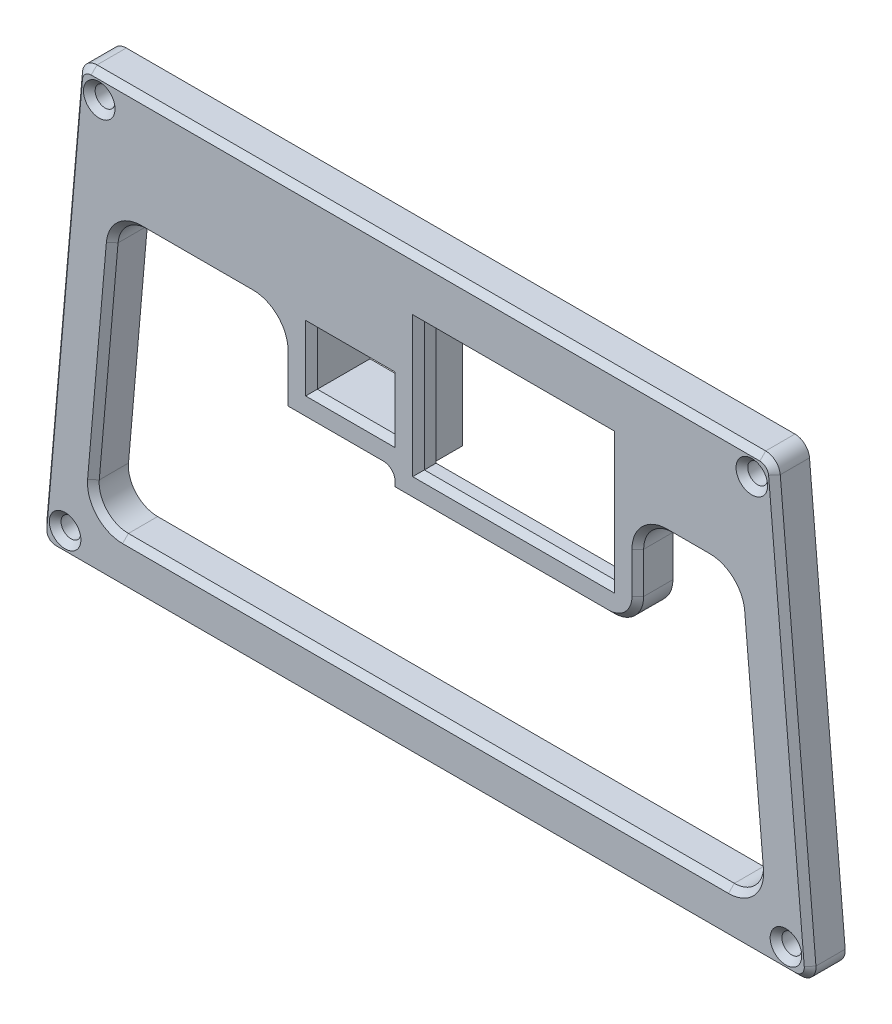
from build123d import *

# Parameters (mm, degrees)
SKETCH1_W                 = 37.50000004
SKETCH1_H                 = 31.999999963
BOSS_EXTRUDE1_DEPTH       = 3
SKETCH2_W                 = 6
SKETCH2_H                 = 61.71460232
BOSS_EXTRUDE2_DEPTH       = 25.662738028
SKETCH3_W                 = 63.162738068
SKETCH3_H                 = 6
BOSS_EXTRUDE3_DEPTH       = 5.000000037
SKETCH4_W                 = 63.162738068
SKETCH4_H                 = 6
BOSS_EXTRUDE4_DEPTH       = 8
SKETCH5_W                 = 6
SKETCH5_H                 = 74.714602357
BOSS_EXTRUDE5_DEPTH       = 55.76390052
CUT_EXTRUDE1_DEPTH        = 2.499999998
SKETCH7_W                 = 6
SKETCH7_H                 = 32.514602357
CUT_EXTRUDE2_DEPTH        = 18.3
SKETCH8_W                 = 6
SKETCH8_H                 = 29.714602357
CUT_EXTRUDE3_DEPTH        = 2.5
SKETCH9_W                 = 6
SKETCH9_H                 = 46.714602358
CUT_EXTRUDE4_DEPTH        = 20.968950764
SKETCH10_W                = 6
SKETCH10_H                = 46.714602357
CUT_EXTRUDE5_DEPTH        = 32.770113219
SKETCH11_W                = 20.8
SKETCH11_H                = 19.200000012
BOSS_EXTRUDE6_DEPTH       = 4
SKETCH12_W                = 32.5
SKETCH12_H                = 22
CUT_EXTRUDE6_DEPTH        = 187.686043948
SKETCH13_W                = 13.3
SKETCH13_H                = 9.2
CUT_EXTRUDE7_DEPTH        = 187.686043948
DRAFT1_ANGLE              = -5
DRAFT2_ANGLE              = 5
F_4_CLEARANCE_HOLE1_D     = 3.4
F_4_CLEARANCE_HOLE1_DEPTH = 10
FILLET1_R                 = 1
FILLET2_R                 = 2.5
FILLET3_R                 = 5
CHAMFER1_SIZE             = 1


with BuildPart() as part:
    # Sketch1 → Boss-Extrude1 (new body)
    with BuildSketch(Plane.XY.offset(3)):
        with Locations((-62.281298008, 105.644197082)):
            Rectangle(SKETCH1_W, SKETCH1_H)
    extrude(amount=-BOSS_EXTRUDE1_DEPTH)

    # Sketch2 → Boss-Extrude2 (add)
    with BuildSketch(Plane(origin=(-43.531297988, 0, 0), x_dir=(0, 0, -1), z_dir=(1, 0, 0))):
        with Locations((0, 90.786895904)):
            Rectangle(SKETCH2_W, SKETCH2_H)
    extrude(amount=BOSS_EXTRUDE2_DEPTH)

    # Sketch3 → Boss-Extrude3 (add)
    with BuildSketch(Plane(origin=(0, 121.644197064, 0), x_dir=(-1, 0, 0), z_dir=(0, 1, 0))):
        with Locations((49.449928994, 0)):
            Rectangle(SKETCH3_W, SKETCH3_H)
    extrude(amount=BOSS_EXTRUDE3_DEPTH)

    # Sketch4 → Boss-Extrude4 (add)
    with BuildSketch(Plane.XZ.offset(-59.929594744)):
        with Locations((-49.449928994, 0)):
            Rectangle(SKETCH4_W, SKETCH4_H)
    extrude(amount=BOSS_EXTRUDE4_DEPTH)

    # Sketch5 → Boss-Extrude5 (add)
    with BuildSketch(Plane.ZY.offset(81.031298028)):
        with Locations((0, 89.286895923)):
            Rectangle(SKETCH5_W, SKETCH5_H)
    extrude(amount=BOSS_EXTRUDE5_DEPTH)

    # Sketch6 → Cut-Extrude1 (cut)
    with BuildSketch(Plane(origin=(-81.031298028, 0, 0), x_dir=(0, 0, -1), z_dir=(1, 0, 0))):
        Polygon((0, 89.644197101), (-3, 89.644197101), (-3, 59.929594744), (3, 59.929594744), (3, 92.444197101), (0, 92.444197101), align=None)
    extrude(amount=-CUT_EXTRUDE1_DEPTH, mode=Mode.SUBTRACT)

    # Sketch7 → Cut-Extrude2 (cut)
    with BuildSketch(Plane(origin=(-83.531298026, 0, 0), x_dir=(0, 0, -1), z_dir=(1, 0, 0))):
        with Locations((0, 76.186895922)):
            Rectangle(SKETCH7_W, SKETCH7_H)
    extrude(amount=-CUT_EXTRUDE2_DEPTH, mode=Mode.SUBTRACT)

    # Sketch8 → Cut-Extrude3 (cut)
    with BuildSketch(Plane.ZY.offset(43.531297988)):
        with Locations((0, 74.786895923)):
            Rectangle(SKETCH8_W, SKETCH8_H)
    extrude(amount=-CUT_EXTRUDE3_DEPTH, mode=Mode.SUBTRACT)

    # Sketch9 → Cut-Extrude4 (cut)
    with BuildSketch(Plane.ZY.offset(41.031297988)):
        with Locations((-1.31e-07, 83.286895949)):
            Rectangle(SKETCH9_W, SKETCH9_H)
    extrude(amount=-CUT_EXTRUDE4_DEPTH, mode=Mode.SUBTRACT)

    # Sketch10 → Cut-Extrude5 (cut)
    with BuildSketch(Plane(origin=(-101.831298026, 0, 0), x_dir=(0, 0, -1), z_dir=(1, 0, 0))):
        with Locations((0, 83.286895923)):
            Rectangle(SKETCH10_W, SKETCH10_H)
    extrude(amount=-CUT_EXTRUDE5_DEPTH, mode=Mode.SUBTRACT)

    # Sketch11 → Boss-Extrude6 (add)
    with BuildSketch(Plane(origin=(0, 0, -3), x_dir=(-1, 0, 0), z_dir=(0, 0, -1))):
        with Locations((91.431298026, 102.044197107)):
            Rectangle(SKETCH11_W, SKETCH11_H)
    extrude(amount=BOSS_EXTRUDE6_DEPTH)

    # Sketch12 → Cut-Extrude6 (cut, through all)
    with BuildSketch(Plane.XY.offset(3)):
        with Locations((-62.281298026, 105.644197101)):
            Rectangle(SKETCH12_W, SKETCH12_H)
    extrude(amount=-CUT_EXTRUDE6_DEPTH, mode=Mode.SUBTRACT)

    # Sketch13 → Cut-Extrude7 (cut, through all)
    with BuildSketch(Plane.XY.offset(3)):
        with Locations((-90.181298026, 102.044197101)):
            Rectangle(SKETCH13_W, SKETCH13_H)
    extrude(amount=-CUT_EXTRUDE7_DEPTH, mode=Mode.SUBTRACT)

    # Draft1
    draft1_faces = [part.faces().sort_by_distance(p)[0] for p in [
        (-20.062347224, 83.286895949, -1.31e-07),
        (-134.601411245, 83.286895923, 0),
    ]]
    draft(draft1_faces, Plane(origin=(0, 59.929594744, 0), x_dir=(1, 0, 0), z_dir=(0, 1, 0)), DRAFT1_ANGLE)

    # Draft2
    draft2_faces = [part.faces().sort_by_distance(p)[0] for p in [
        (-136.795198548, 89.286895923, 0),
        (-17.86855996, 89.286895923, 0),
    ]]
    draft(draft2_faces, Plane.ZX.offset(126.644197101), DRAFT2_ANGLE)

    # #4 Clearance Hole1
    with Locations(Plane.XY.offset(3)):
        with Locations((-21.533884656, 122.644197101), (-133.129873852, 122.644197101), (-138.966645249, 55.929594744), (-15.697113258, 55.929594744)):
            Hole(F_4_CLEARANCE_HOLE1_D / 2, depth=F_4_CLEARANCE_HOLE1_DEPTH)

    # Fillet1
    fillet1_edges = [part.edges().sort_by_distance(p)[0] for p in [
        (-83.531298026, 89.644197101, 1.5),
        (-101.831298026, 92.444197101, -2),
        (-83.531298026, 92.444197101, 1.5),
    ]]
    fillet(fillet1_edges, radius=FILLET1_R)

    # Fillet2
    fillet2_edges = [part.edges().sort_by_distance(p)[0] for p in [
        (-17.86855996, 126.644197101, 0),
        (-11.331879254, 51.929594744, 0),
        (-136.795198548, 126.644197101, 0),
        (-143.331879255, 51.929594744, 0),
    ]]
    fillet(fillet2_edges, radius=FILLET2_R)

    # Fillet3
    fillet3_edges = [part.edges().sort_by_distance(p)[0] for p in [
        (-101.831298026, 106.644197101, 0),
        (-41.031297988, 106.644197128, -1.31e-07),
        (-41.031297988, 89.644197101, 0),
        (-20.062347226, 59.92959477, 0),
        (-24.149345354, 106.644197128, 0),
        (-130.514413118, 106.644197101, 0),
        (-134.601411243, 59.92959477, 0),
    ]]
    fillet(fillet3_edges, radius=FILLET3_R)

    # Chamfer1
    chamfer1_edges = [part.edges().sort_by_distance(p)[0] for p in [
        (-46.031298026, 105.644197101, 3),
        (-62.281298026, 116.644197101, 3),
        (-78.531298026, 105.644197101, 3),
        (-62.281298026, 94.644197101, 3),
        (-90.181298026, 106.644197101, 3),
        (-96.831298026, 102.044197101, 3),
        (-90.181298026, 97.444197101, 3),
        (-83.531298026, 102.044197101, 3),
        (-13.997113258, 55.929594744, 3),
        (-137.266645249, 55.929594744, 3),
        (-131.429873852, 122.644197101, 3),
        (-19.833884656, 122.644197101, 3),
        (-92.681298026, 92.444197101, 3),
        (-83.531298026, 91.044197101, 3),
        (-64.281298007, 89.644197101, 3),
        (-101.538404807, 92.73709032, 3),
        (-83.238404807, 89.93709032, 3),
        (-83.824191245, 92.151303882, 3),
        (-77.331879254, 51.929594744, 3),
        (-77.331879254, 126.644197101, 3),
        (-140.044476053, 89.504785279, 3),
        (-14.619282455, 89.504785279, 3),
        (-136.193346132, 125.987390443, 3),
        (-18.470412376, 125.987390443, 3),
        (-142.446801344, 52.740619225, 3),
        (-12.216957164, 52.740619225, 3),
        (-116.382027637, 106.644197101, 3),
        (-101.831298026, 97.544197101, 3),
        (-32.381149606, 106.644197128, 2.999999869),
        (-41.031297988, 98.144197115, 2.999999869),
        (-22.143971987, 83.722674663, 3),
        (-61.031298008, 59.929594744, 3),
        (-132.519786483, 83.722674649, 3),
        (-42.495764082, 91.108663195, 3),
        (-103.29576412, 105.179731007, 3),
        (-39.566831894, 105.179731034, 3),
        (-21.832503047, 61.551643732, 3),
        (-25.353050186, 105.330583812, 3),
        (-129.310708286, 105.330583785, 3),
        (-132.831255421, 61.551643732, 3),
    ]]
    chamfer(chamfer1_edges, length=CHAMFER1_SIZE - 0.0001)  # a hair under: the kernel refuses the full size


solid = part.part
